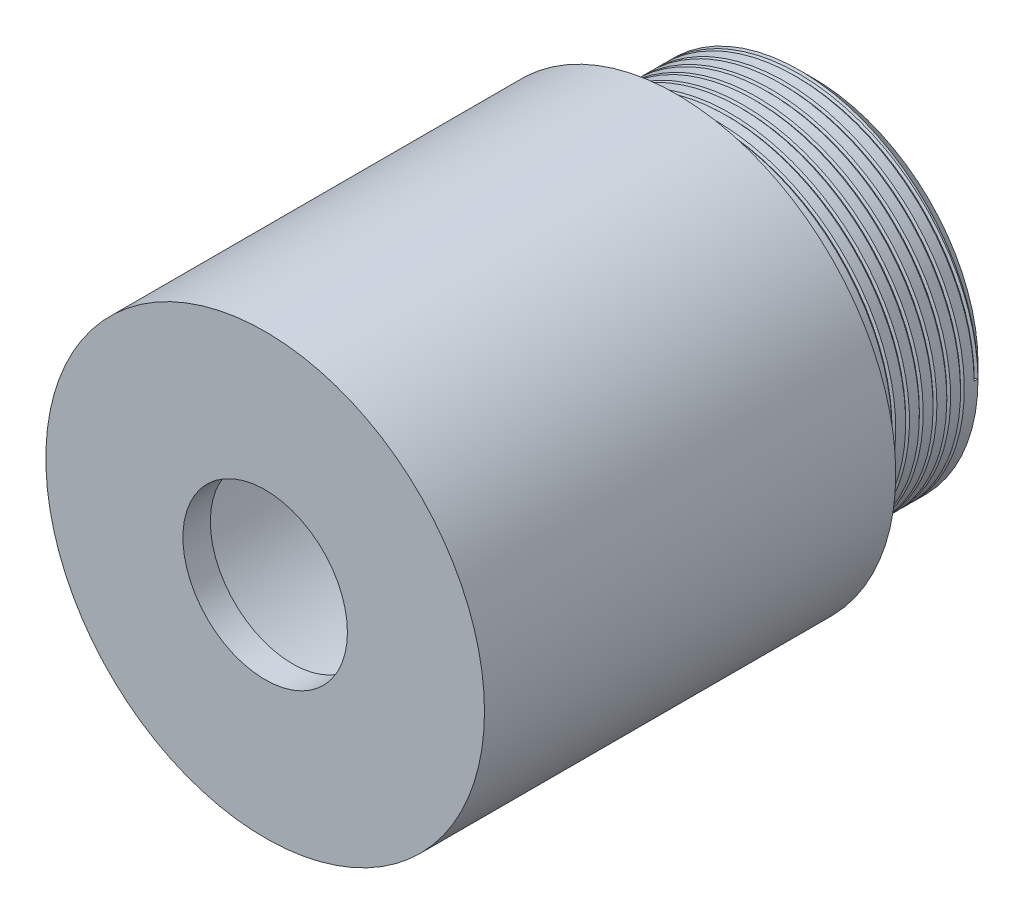
from build123d import *

# Parameters (mm, degrees)
IZIM1_R                     = 13
Y_KSEKLIK_EKSTR_ZYON1_DEPTH = 10
IZIM2_R                     = 16
Y_KSEKLIK_EKSTR_ZYON2_DEPTH = 30
IZIM3_R                     = 11
KES_EKSTR_ZYON1_DEPTH       = 38
IZIM4_R                     = 6
KES_EKSTR_ZYON2_DEPTH       = 38
PAH1_SIZE                   = 1
DI_1_PITCH                  = 1


with BuildPart() as part:
    # Çizim1 → Yükseklik-Ekstrüzyon1 (new body)
    with BuildSketch(Plane.XY):
        Circle(IZIM1_R)
    extrude(amount=Y_KSEKLIK_EKSTR_ZYON1_DEPTH)

    # Çizim2 → Yükseklik-Ekstrüzyon2 (add)
    with BuildSketch(Plane.XY.offset(10)):
        Circle(IZIM2_R)
    extrude(amount=Y_KSEKLIK_EKSTR_ZYON2_DEPTH)

    # Çizim3 → Kes-Ekstrüzyon1 (cut)
    with BuildSketch(Plane(origin=(0, 0, 0), x_dir=(-1, 0, 0), z_dir=(0, 0, -1))):
        Circle(IZIM3_R)
    extrude(amount=-KES_EKSTR_ZYON1_DEPTH, mode=Mode.SUBTRACT)

    # Çizim4 → Kes-Ekstrüzyon2 (cut)
    with BuildSketch(Plane.XY.offset(40)):
        Circle(IZIM4_R)
    extrude(amount=-KES_EKSTR_ZYON2_DEPTH, mode=Mode.SUBTRACT)

    # Pah1
    pah1_edges = [part.edges().sort_by_distance(p)[0] for p in [
        (-13, 0, 0),
    ]]
    chamfer(pah1_edges, length=PAH1_SIZE)

    # Diş1: the profile of Diş Profili1 profile screwed along a right-hand helix of 10 turns, 8 arcs to a turn; built about Z, then put on its axis
    di_1_z = Axis((0, 0, 0), (0, 0, 1))
    di_1_corners = [(13.0003, 0, -0.000173205), (13.0003, 0, 0.277985704), (12.828148085, 0, 0.17859375), (12.828148085, 0, 0.09921875)]
    with BuildLine(mode=Mode.PRIVATE) as di_1_profile:
        Line(di_1_corners[0], di_1_corners[1])
        Line(di_1_corners[1], di_1_corners[2])
        Line(di_1_corners[2], di_1_corners[3])
        Line(di_1_corners[3], di_1_corners[0])
    di_1_cap = Face(di_1_profile.wire())
    di_1_turn_angles = [0, 22.5, 45, 67.5, 90, 112.5, 135, 157.5, 180, 202.5, 225, 247.5, 270, 292.5, 315, 337.5, 360]
    di_1_turn_weights = [1, 0.9238795325112867, 1, 0.9238795325112867, 1, 0.9238795325112867, 1, 0.9238795325112867, 1, 0.9238795325112867, 1, 0.9238795325112867, 1, 0.9238795325112867, 1, 0.9238795325112867, 1]
    di_1_turn_rails = [Edge.make_bspline([Vector(p[0], p[1], 0).rotate(di_1_z, di_1_turn_angles[k]) / di_1_turn_weights[k] + Vector(0, 0, p[2] + DI_1_PITCH * di_1_turn_angles[k] / 360) for k in range(17)], [0, 0, 0, 1, 1, 2, 2, 3, 3, 4, 4, 5, 5, 6, 6, 7, 7, 8, 8, 8], 2, di_1_turn_weights) for p in di_1_corners]
    di_1_turn_sides = [Face.make_surface_from_curves(di_1_turn_rails[p[0]], di_1_turn_rails[p[1]]) for p in [(0, 1), (1, 2), (2, 3), (3, 0)]]
    di_1 = Plane(origin=(0, 0, 1), x_dir=(1, 0, 0), z_dir=(0, 0, 1)) * Solid(Shell([*[p.moved(Location((0, 0, DI_1_PITCH * i))) for i in range(10) for p in di_1_turn_sides], di_1_cap, di_1_cap.rotate(di_1_z, 3600).moved(Location((0, 0, DI_1_PITCH * 3600 / 360)))]))
    add(di_1, mode=Mode.SUBTRACT)


solid = part.part
